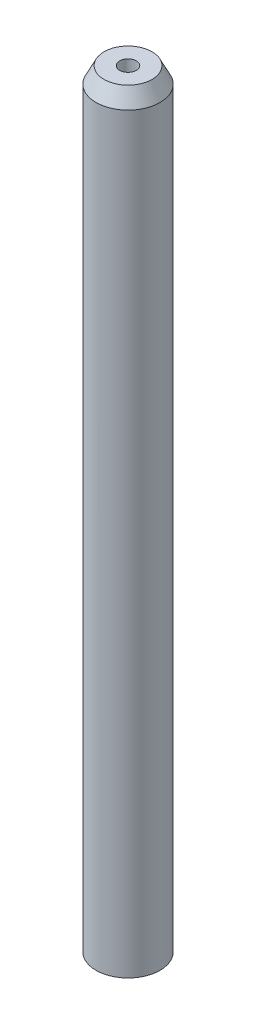
from build123d import *

# Parameters (mm, degrees)
SKETCH1_R                 = 6.35
POSTBODY_DEPTH            = 152.4
M4X0_7_TAPPED_HOLE1_D     = 3.3
M4X0_7_TAPPED_HOLE1_DEPTH = 9.525
M4X0_7_TAPPED_HOLE1_TIP   = 0.991420021
M6X1_0_TAPPED_HOLE1_D     = 5
M6X1_0_TAPPED_HOLE1_DEPTH = 12.7
M6X1_0_TAPPED_HOLE1_TIP   = 1.502151548


with BuildPart() as part:
    # Sketch1 → PostBody (new body)
    with BuildSketch(Plane(origin=(0, 0, 0), x_dir=(1, 0, 0), z_dir=(0, 1, 0))):
        Circle(SKETCH1_R)
    extrude(amount=POSTBODY_DEPTH)

    # TopCut: sweep along a path in Sketch5
    with BuildLine(Plane(origin=(0, 152.4, 0), x_dir=(1, 0, 0), z_dir=(0, 1, 0))) as topcut_path:
        CenterArc((0, 0), 4.748740119, 0, 360)
    # Sketch4 → TopCut (sweep, cut)
    with BuildSketch(Plane.XY):
        Polygon((6.35, 152.4), (6.35, 149.225), (4.7625, 152.4), align=None)
    sweep(path=topcut_path.line, mode=Mode.SUBTRACT)

    # M4x0.7 Tapped Hole1
    with Locations(Plane(origin=(0, 152.4, 0), x_dir=(1, 0, 0), z_dir=(0, 1, 0))):
        with Locations((0, 0)):
            Hole(M4X0_7_TAPPED_HOLE1_D / 2, depth=M4X0_7_TAPPED_HOLE1_DEPTH)
            with Locations((0, 0, -(M4X0_7_TAPPED_HOLE1_DEPTH + M4X0_7_TAPPED_HOLE1_TIP / 2))):  # 118° drill point
                Cone(0, M4X0_7_TAPPED_HOLE1_D / 2, M4X0_7_TAPPED_HOLE1_TIP, mode=Mode.SUBTRACT)

    # M6x1.0 Tapped Hole1
    with Locations(Plane(origin=(0, 0, 0), x_dir=(-1, 0, 0), z_dir=(0, -1, 0))):
        with Locations((0, 0)):
            Hole(M6X1_0_TAPPED_HOLE1_D / 2, depth=M6X1_0_TAPPED_HOLE1_DEPTH)
            with Locations((0, 0, -(M6X1_0_TAPPED_HOLE1_DEPTH + M6X1_0_TAPPED_HOLE1_TIP / 2))):  # 118° drill point
                Cone(0, M6X1_0_TAPPED_HOLE1_D / 2, M6X1_0_TAPPED_HOLE1_TIP, mode=Mode.SUBTRACT)


solid = part.part
